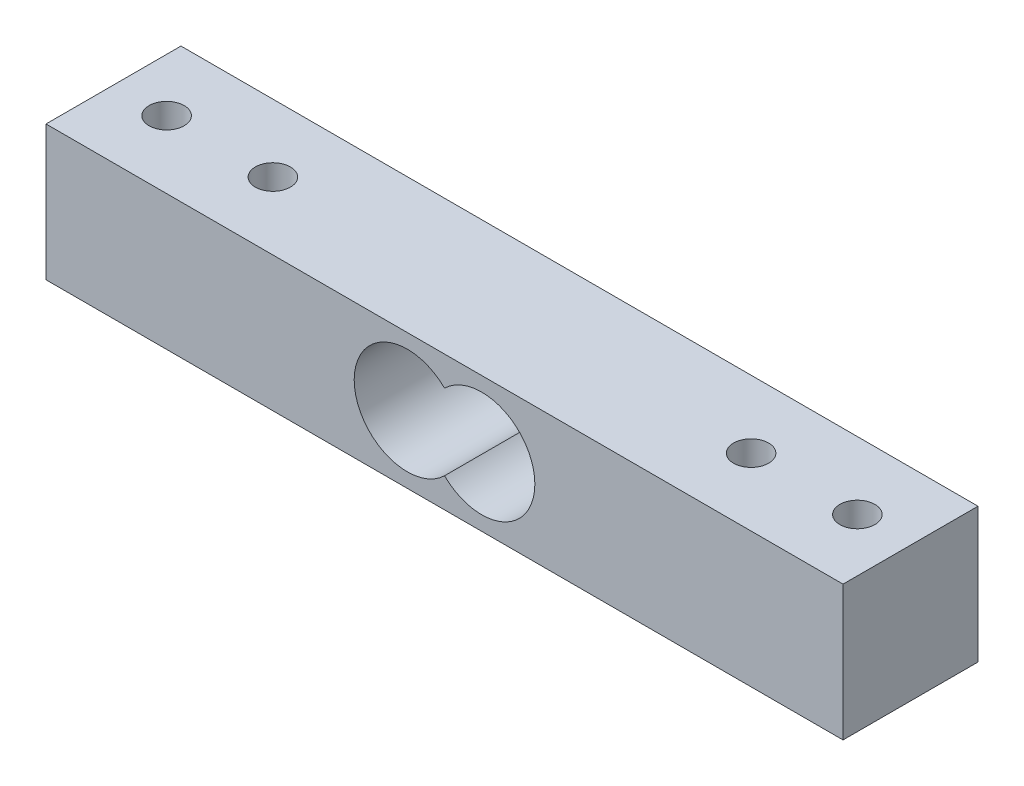
from build123d import *

# Parameters (mm, degrees)
AUFSATZ_LINEAR_AUSTRAGEN1_DEPTH      = 6.35
AUFSATZ_LINEAR_AUSTRAGEN1_DEPTH_BACK = 6.35
SKIZZE2_W                            = 75
SKIZZE2_H                            = 12.7
SKIZZE2_R                            = 1.65
SCHNITT_LINEAR_AUSTRAGEN2_DEPTH      = 39.560277489
SCHNITT_LINEAR_AUSTRAGEN2_DEPTH_BACK = 39.560277489


with BuildPart() as part:
    # Skizze2 → Aufsatz-Linear austragen1 (new, two sides: drawn at the far end of the back side and taken through both)
    with BuildSketch(Plane(origin=(0, 0, 0), x_dir=(1, 0, 0), z_dir=(0, 1, 0)).offset(-AUFSATZ_LINEAR_AUSTRAGEN1_DEPTH_BACK)):
        Rectangle(SKIZZE2_W, SKIZZE2_H)
        with Locations((-22.5, 0)):
            Circle(SKIZZE2_R, mode=Mode.SUBTRACT)
        with Locations((-32.5, 0)):
            Circle(SKIZZE2_R, mode=Mode.SUBTRACT)
        with Locations((22.5, 0)):
            Circle(SKIZZE2_R, mode=Mode.SUBTRACT)
        with Locations((32.5, 0)):
            Circle(SKIZZE2_R, mode=Mode.SUBTRACT)
    extrude(amount=AUFSATZ_LINEAR_AUSTRAGEN1_DEPTH + AUFSATZ_LINEAR_AUSTRAGEN1_DEPTH_BACK)

    # Skizze3 → Schnitt-Linear austragen2 (cut, two sides: drawn at the far end of the back side and taken through both)
    with BuildSketch(Plane.XY.offset(-SCHNITT_LINEAR_AUSTRAGEN2_DEPTH_BACK)):
        with BuildLine():
            ThreePointArc((0, 3.570714214), (-8.5, 0), (0, -3.570714214))
            ThreePointArc((0, -3.570714214), (8.5, 0), (0, 3.570714214))
        make_face()
    extrude(amount=SCHNITT_LINEAR_AUSTRAGEN2_DEPTH + SCHNITT_LINEAR_AUSTRAGEN2_DEPTH_BACK, mode=Mode.SUBTRACT)


solid = part.part
